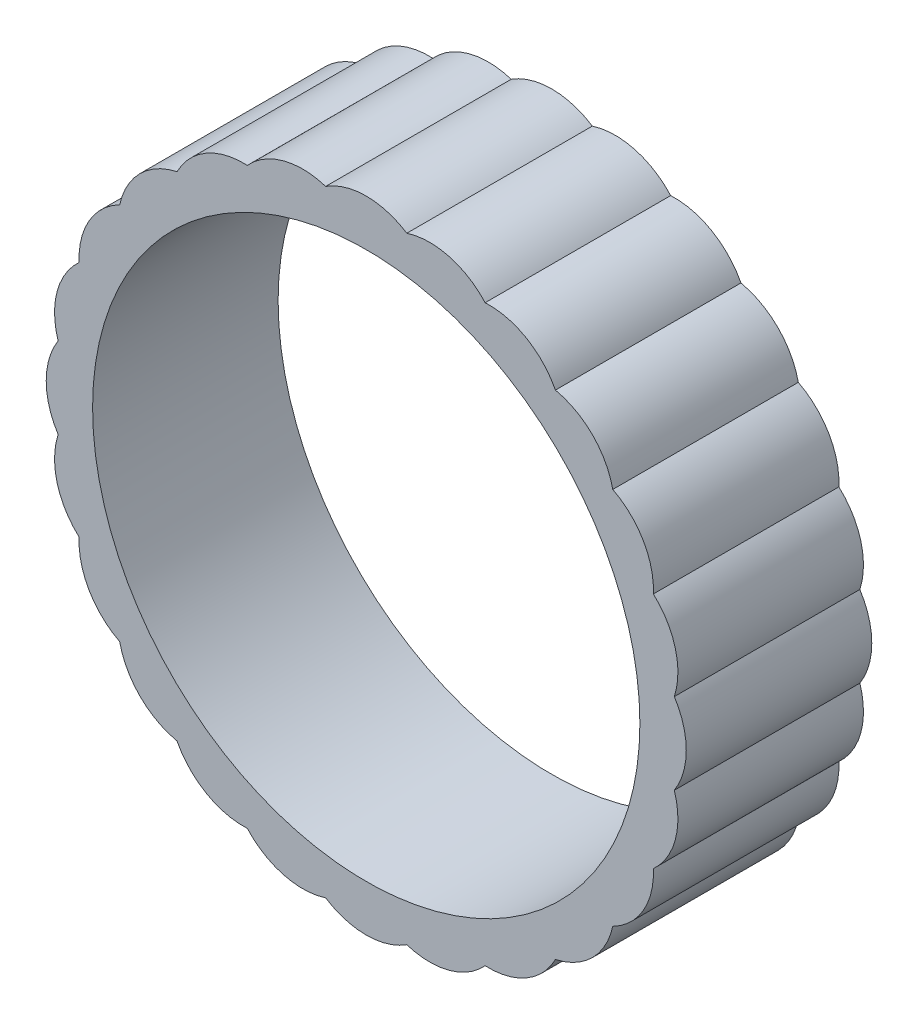
from build123d import *

# Parameters (mm, degrees)
SKETCH1_R           = 16.75
SKETCH1_R_2         = 14.75
BOSS_EXTRUDE1_DEPTH = 10
BOSS_EXTRUDE2_START = -10
BOSS_EXTRUDE2_DEPTH = 10
CIRPATTERN1_COUNT   = 24


with BuildPart() as part:
    # Sketch1 → Boss-Extrude1 (new body)
    with BuildSketch(Plane.XY):
        Circle(SKETCH1_R)
        Circle(SKETCH1_R_2, mode=Mode.SUBTRACT)
    extrude(amount=BOSS_EXTRUDE1_DEPTH)

    # Sketch2 → Boss-Extrude2 (add)
    with BuildSketch(Plane.XY.offset(10).offset(BOSS_EXTRUDE2_START)):
        with BuildLine():
            ThreePointArc((-2.18631372, 16.606701428), (0, 17.25), (2.18631372, 16.606701428))
            ThreePointArc((2.18631372, 16.606701428), (0, 16.75), (-2.18631372, 16.606701428))
        make_face()
    boss_extrude2 = extrude(amount=BOSS_EXTRUDE2_DEPTH)

    # CirPattern1: Boss-Extrude2 ×24 about axis
    cirpattern1_axis = Axis((0, 0, 10), (0, 0, 1))
    for i in range(1, CIRPATTERN1_COUNT):
        add(boss_extrude2.rotate(cirpattern1_axis, i * 360 / CIRPATTERN1_COUNT))


solid = part.part
